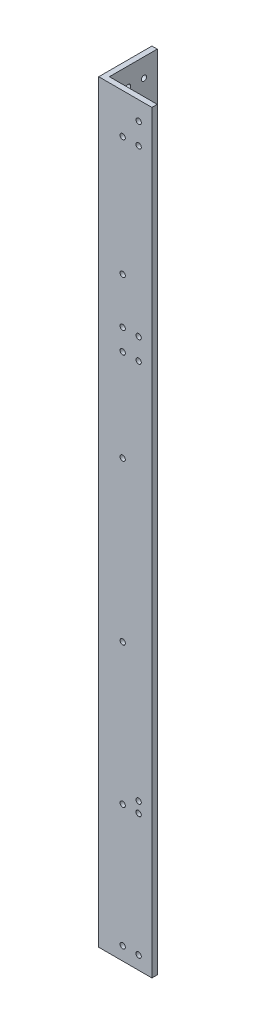
from build123d import *

# Parameters (mm, degrees)
BOSS_EXTRUDE1_DEPTH              = 450
LEFTSIDEHOLES_SKETCH3_R          = 1.5875
LEFTSIDEHOLES_CUT_EXTRUDE1_DEPTH = 3.175
BACKSIDEHOLES_SKETCH4_R          = 1.5875
BACKSIDEHOLES_CUT_EXTRUDE2_DEPTH = 3.175


with BuildPart() as part:
    # Sketch2 → Boss-Extrude1 (new body)
    with BuildSketch(Plane(origin=(0, 0, 0), x_dir=(1, 0, 0), z_dir=(0, 1, 0))):
        Polygon((0, 31.75), (3.175, 31.75), (3.175, 3.175), (31.75, 3.175), (31.75, 0), (0, 0), align=None)
    extrude(amount=BOSS_EXTRUDE1_DEPTH)

    # LeftSideHoles-Sketch3 → LeftSideHoles-Cut-Extrude1 (cut)
    with BuildSketch(Plane.XY):
        with Locations((14.2875, 81.1125)):
            Circle(LEFTSIDEHOLES_SKETCH3_R)
        with Locations((23.8125, 81.1125)):
            Circle(LEFTSIDEHOLES_SKETCH3_R)
        with Locations((23.8125, 87.4625)):
            Circle(LEFTSIDEHOLES_SKETCH3_R)
        with Locations((14.2875, 426.1875)):
            Circle(LEFTSIDEHOLES_SKETCH3_R)
        with Locations((23.8125, 438.8875)):
            Circle(LEFTSIDEHOLES_SKETCH3_R)
        with Locations((23.8125, 426.1875)):
            Circle(LEFTSIDEHOLES_SKETCH3_R)
        with Locations((14.2875, 327.602644)):
            Circle(LEFTSIDEHOLES_SKETCH3_R)
        with Locations((23.8125, 327.602644)):
            Circle(LEFTSIDEHOLES_SKETCH3_R)
        with Locations((14.2875, 314.902644)):
            Circle(LEFTSIDEHOLES_SKETCH3_R)
        with Locations((23.8125, 314.902644)):
            Circle(LEFTSIDEHOLES_SKETCH3_R)
        with Locations((14.2875, 7.9375)):
            Circle(LEFTSIDEHOLES_SKETCH3_R)
        with Locations((23.8125, 7.9375)):
            Circle(LEFTSIDEHOLES_SKETCH3_R)
        with Locations((14.2875, 165)):
            Circle(LEFTSIDEHOLES_SKETCH3_R)
        with Locations((14.2875, 260)):
            Circle(LEFTSIDEHOLES_SKETCH3_R)
        with Locations((14.2875, 355)):
            Circle(LEFTSIDEHOLES_SKETCH3_R)
    extrude(amount=-LEFTSIDEHOLES_CUT_EXTRUDE1_DEPTH, mode=Mode.SUBTRACT)

    # BackSideHoles-Sketch4 → BackSideHoles-Cut-Extrude2 (cut)
    with BuildSketch(Plane.ZY):
        with Locations((-23.8125, 81.1125)):
            Circle(BACKSIDEHOLES_SKETCH4_R)
        with Locations((-23.8125, 87.4625)):
            Circle(BACKSIDEHOLES_SKETCH4_R)
        with Locations((-14.2875, 87.4625)):
            Circle(BACKSIDEHOLES_SKETCH4_R)
        with Locations((-23.8125, 438.8875)):
            Circle(BACKSIDEHOLES_SKETCH4_R)
        with Locations((-14.2875, 438.8875)):
            Circle(BACKSIDEHOLES_SKETCH4_R)
        with Locations((-23.8125, 426.1875)):
            Circle(BACKSIDEHOLES_SKETCH4_R)
        with Locations((-23.8125, 327.602644)):
            Circle(BACKSIDEHOLES_SKETCH4_R)
        with Locations((-14.2875, 327.602644)):
            Circle(BACKSIDEHOLES_SKETCH4_R)
        with Locations((-23.8125, 321.252644)):
            Circle(BACKSIDEHOLES_SKETCH4_R)
        with Locations((-14.2875, 321.252644)):
            Circle(BACKSIDEHOLES_SKETCH4_R)
        with Locations((-14.2875, 165)):
            Circle(BACKSIDEHOLES_SKETCH4_R)
        with Locations((-14.2875, 260)):
            Circle(BACKSIDEHOLES_SKETCH4_R)
        with Locations((-14.2875, 355)):
            Circle(BACKSIDEHOLES_SKETCH4_R)
        with Locations((-23.8125, 7.9375)):
            Circle(BACKSIDEHOLES_SKETCH4_R)
        with Locations((-14.2875, 7.9375)):
            Circle(BACKSIDEHOLES_SKETCH4_R)
    extrude(amount=-BACKSIDEHOLES_CUT_EXTRUDE2_DEPTH, mode=Mode.SUBTRACT)


solid = part.part
